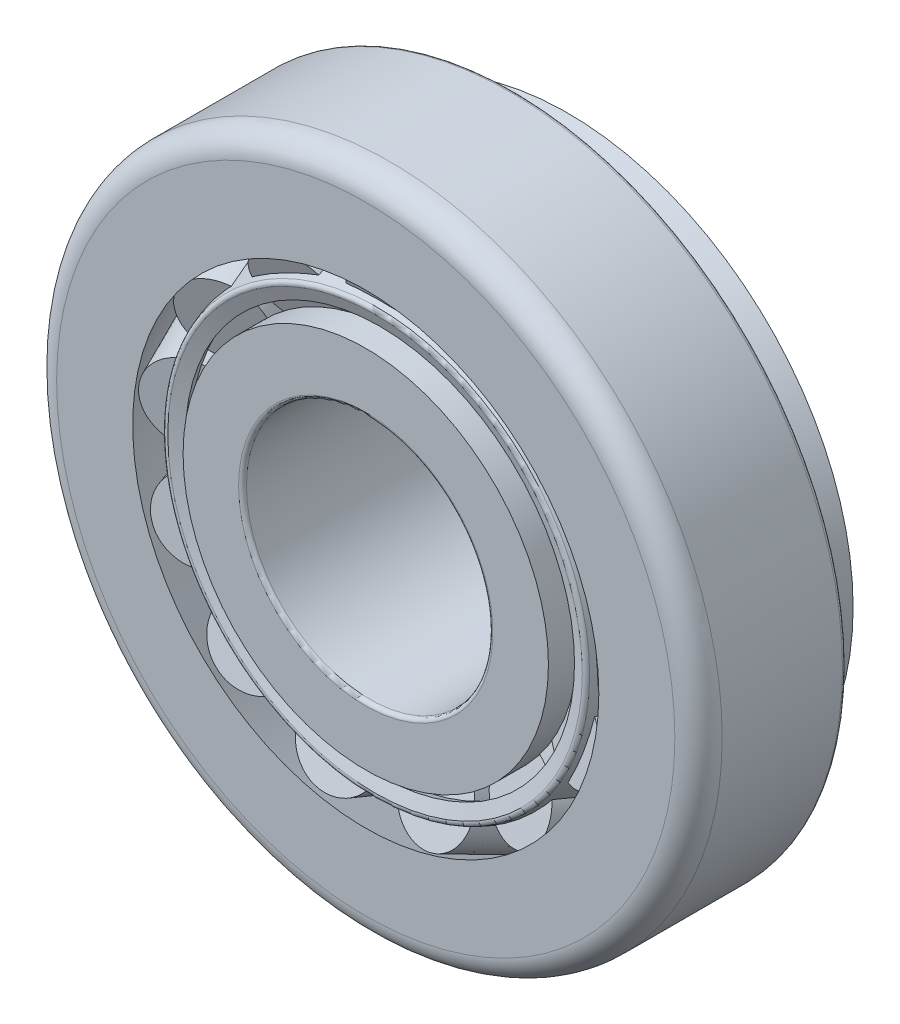
from build123d import *

# Parameters (mm, degrees)
CIRPATTERN1_COUNT = 13
FILLET1_R         = 1.524
FILLET2_R         = 1.524
FILLET3_R         = 0.254
FILLET4_R         = 0.254
FILLET5_R         = 0.254


with BuildPart() as part:
    # Sketch2 → Revolve1 (revolve)
    with BuildSketch(Plane(origin=(0, 0, 0), x_dir=(0, 0, -1), z_dir=(1, 0, 0))):
        Polygon((-4.7625, 21.43125), (-4.7625, 15.01), (4.7625, 19.47), (4.7625, 21.43125), align=None)
    revolve(axis=Axis((0, 0, 0), (0, 0, -1)))

    # Fillet2
    fillet2_edges = [part.edges().sort_by_distance(p)[0] for p in [
        (0, -21.43125, 4.7625),
    ]]
    fillet(fillet2_edges, radius=FILLET2_R)

    # Fillet4
    fillet4_edges = [part.edges().sort_by_distance(p)[0] for p in [
        (0, -21.43125, -4.7625),
    ]]
    fillet(fillet4_edges, radius=FILLET4_R)


with BuildPart() as body_2:
    # Sketch3 → Revolve2 (revolve)
    with BuildSketch(Plane(origin=(0, 0, 0), x_dir=(0, 0, -1), z_dir=(1, 0, 0))):
        Polygon((-4.7625, 11.765), (-4.7625, 7.9375), (9.525, 7.9375), (9.525, 14.9), (5.901968599, 14.9), (6.54984645, 13.213839579), (-2.407233218, 10.484636613), (-2.899190607, 11.765), align=None)
    revolve(axis=Axis((0, 0, 0), (0, 0, -1)))

    # Fillet1
    fillet1_edges = [body_2.edges().sort_by_distance(p)[0] for p in [
        (0, -7.9375, -9.525),
    ]]
    fillet(fillet1_edges, radius=FILLET1_R)

    # Fillet3
    fillet3_edges = [body_2.edges().sort_by_distance(p)[0] for p in [
        (0, -7.9375, 4.7625),
    ]]
    fillet(fillet3_edges, radius=FILLET3_R)


with BuildPart() as body_3:
    # Sketch4 → Revolve3 (revolve)
    with BuildSketch(Plane(origin=(0, 0, 0), x_dir=(0, 0, -1), z_dir=(1, 0, 0))):
        Polygon((8.509, 17.683941985), (8.239999141, 18.384040934), (-4.2545, 13.583246687), (-3.850998711, 12.533098264), (-3.150899763, 12.802099123), (-3.285400192, 13.152148598), align=None)
    revolve(axis=Axis((0, 0, 0), (0, 0, -1)))

    # Fillet5
    fillet5_edges = [body_3.edges().sort_by_distance(p)[0] for p in [
        (0, -13.583246687, 4.2545),
    ]]
    fillet(fillet5_edges, radius=FILLET5_R)


with BuildPart() as body_4:
    # Sketch6 → Revolve4 (revolve)
    with BuildSketch(Plane(origin=(0, 0, 0), x_dir=(0, 0, -1), z_dir=(1, 0, 0))):
        Polygon((6.54984645, 13.213839579), (5.394936094, 16.219597732), (-3.323629478, 12.869640365), (-2.407233218, 10.484636613), align=None)
    revolve(axis=Axis((0, 12.869640365, 3.323629478), (0, 0.3586678122903271, -0.933465264713621)))


with BuildPart() as cirpattern1_1:
    # CirPattern1: pattern copy
    add(body_4.part.rotate(Axis((0, 0, 0), (0, 0, -1)), 1 * 360 / CIRPATTERN1_COUNT))


with BuildPart() as cirpattern1_2:
    # CirPattern1: pattern copy
    add(body_4.part.rotate(Axis((0, 0, 0), (0, 0, -1)), 2 * 360 / CIRPATTERN1_COUNT))


with BuildPart() as cirpattern1_3:
    # CirPattern1: pattern copy
    add(body_4.part.rotate(Axis((0, 0, 0), (0, 0, -1)), 3 * 360 / CIRPATTERN1_COUNT))


with BuildPart() as cirpattern1_4:
    # CirPattern1: pattern copy
    add(body_4.part.rotate(Axis((0, 0, 0), (0, 0, -1)), 4 * 360 / CIRPATTERN1_COUNT))


with BuildPart() as cirpattern1_5:
    # CirPattern1: pattern copy
    add(body_4.part.rotate(Axis((0, 0, 0), (0, 0, -1)), 5 * 360 / CIRPATTERN1_COUNT))


with BuildPart() as cirpattern1_6:
    # CirPattern1: pattern copy
    add(body_4.part.rotate(Axis((0, 0, 0), (0, 0, -1)), 6 * 360 / CIRPATTERN1_COUNT))


with BuildPart() as cirpattern1_7:
    # CirPattern1: pattern copy
    add(body_4.part.rotate(Axis((0, 0, 0), (0, 0, -1)), 7 * 360 / CIRPATTERN1_COUNT))


with BuildPart() as cirpattern1_8:
    # CirPattern1: pattern copy
    add(body_4.part.rotate(Axis((0, 0, 0), (0, 0, -1)), 8 * 360 / CIRPATTERN1_COUNT))


with BuildPart() as cirpattern1_9:
    # CirPattern1: pattern copy
    add(body_4.part.rotate(Axis((0, 0, 0), (0, 0, -1)), 9 * 360 / CIRPATTERN1_COUNT))


with BuildPart() as cirpattern1_10:
    # CirPattern1: pattern copy
    add(body_4.part.rotate(Axis((0, 0, 0), (0, 0, -1)), 10 * 360 / CIRPATTERN1_COUNT))


with BuildPart() as cirpattern1_11:
    # CirPattern1: pattern copy
    add(body_4.part.rotate(Axis((0, 0, 0), (0, 0, -1)), 11 * 360 / CIRPATTERN1_COUNT))


with BuildPart() as cirpattern1_12:
    # CirPattern1: pattern copy
    add(body_4.part.rotate(Axis((0, 0, 0), (0, 0, -1)), 12 * 360 / CIRPATTERN1_COUNT))


solid = Compound([part.part, body_2.part, body_3.part, body_4.part, cirpattern1_1.part, cirpattern1_2.part, cirpattern1_3.part, cirpattern1_4.part, cirpattern1_5.part, cirpattern1_6.part, cirpattern1_7.part, cirpattern1_8.part, cirpattern1_9.part, cirpattern1_10.part, cirpattern1_11.part, cirpattern1_12.part])
